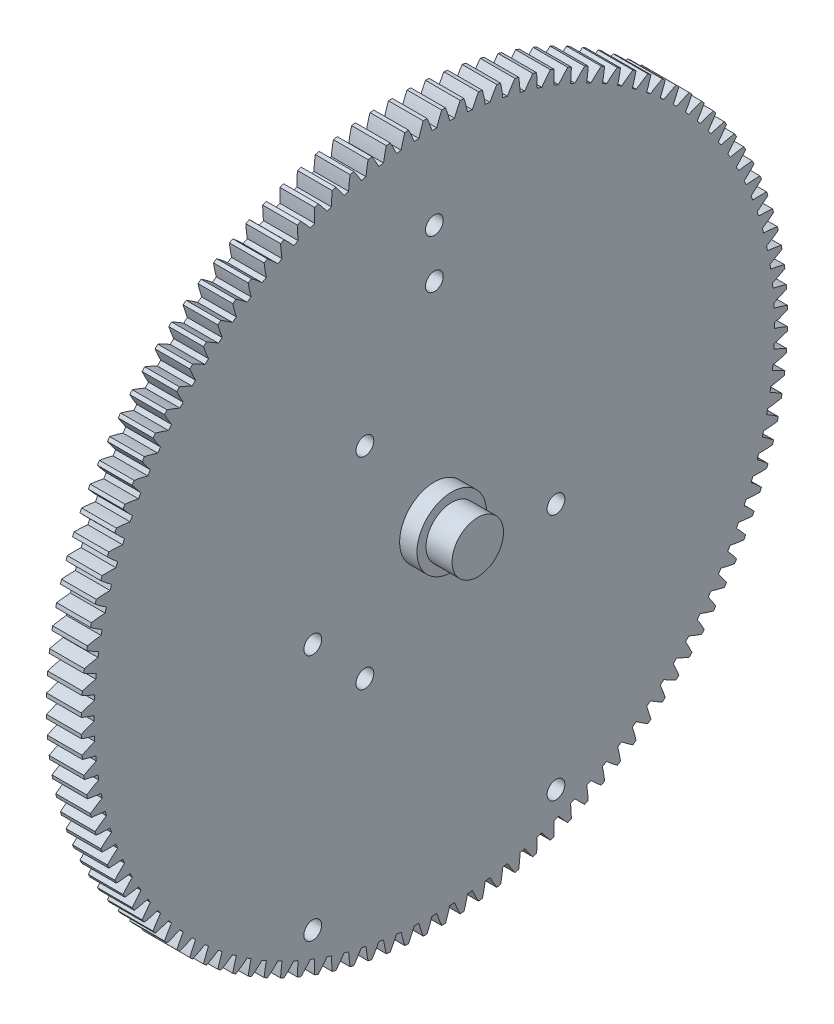
from build123d import *

# Parameters (mm, degrees)
BASPROSKE_W         = 12.7
BASPROSKE_H         = 129.116666667
TOOTHCUT_DEPTH      = 184.039660244
TEETHCUTS_COUNT     = 120
TEETHCUTS_ANGLE     = 357
SKETCH1_R           = 3.2512
CUT_EXTRUDE1_DEPTH  = 184.00052935
SKETCH2_R           = 12.699999999
BOSS_EXTRUDE1_DEPTH = 6.35
SKETCH3_R           = 9.397999999
BOSS_EXTRUDE2_DEPTH = 9.525


with BuildPart() as part:
    # BasProSke → Base-Revolve (revolve)
    with BuildSketch(Plane(origin=(0, 0, 0), x_dir=(1, 0, 0), z_dir=(0, 1, 0))):
        with Locations((6.35, 64.558333334)):
            Rectangle(BASPROSKE_W, BASPROSKE_H)
    revolve(axis=Axis((-10, 0, 0), (1, 0, 0)))

    # TooCutSke → ToothCut (cut, through all)
    with BuildSketch(Plane(origin=(0, 0, 0), x_dir=(0, 0, -1), z_dir=(1, 0, 0))):
        with BuildLine():
            ThreePointArc((0.87803111, 124.349796826), (0, 124.352896667), (-0.87803111, 124.349796826))
            ThreePointArc((-0.87803111, 124.349796826), (-1.722818551, 126.754652472), (-2.687169681, 129.114106518))
            ThreePointArc((-2.687169681, 129.114106518), (0, 129.142066667), (2.687169681, 129.114106518))
            ThreePointArc((2.687169681, 129.114106518), (1.722818551, 126.754652472), (0.87803111, 124.349796826))
        make_face()
    toothcut = extrude(amount=TOOTHCUT_DEPTH, mode=Mode.SUBTRACT)

    # TeethCuts: ToothCut ×120 about axis
    teethcuts_axis = Axis((-10, 0, 0), (1, 0, 0))
    for i in range(1, TEETHCUTS_COUNT):
        add(toothcut.rotate(teethcuts_axis, i * TEETHCUTS_ANGLE / (TEETHCUTS_COUNT - 1)), mode=Mode.SUBTRACT)

    # Sketch1 → Cut-Extrude1 (cut, through all)
    with BuildSketch(Plane.ZY):
        with Locations((25.4, 36.83)):
            Circle(SKETCH1_R)
        with Locations((25.4, -36.83)):
            Circle(SKETCH1_R)
        with Locations((0, 93.98)):
            Circle(SKETCH1_R)
        with Locations((0, 76.2)):
            Circle(SKETCH1_R)
        with Locations((44.45, -16.51)):
            Circle(SKETCH1_R)
        with Locations((44.45, -106.934)):
            Circle(SKETCH1_R)
        with Locations((-44.45, -106.934)):
            Circle(SKETCH1_R)
        with Locations((-44.45, -16.51)):
            Circle(SKETCH1_R)
    extrude(amount=-CUT_EXTRUDE1_DEPTH, mode=Mode.SUBTRACT)

    # Sketch2 → Boss-Extrude1 (add)
    with BuildSketch(Plane(origin=(12.7, 0, 0), x_dir=(0, 0, -1), z_dir=(1, 0, 0))):
        Circle(SKETCH2_R)
    extrude(amount=BOSS_EXTRUDE1_DEPTH)

    # Sketch3 → Boss-Extrude2 (add)
    with BuildSketch(Plane(origin=(19.05, 0, 0), x_dir=(0, 0, -1), z_dir=(1, 0, 0))):
        Circle(SKETCH3_R)
    extrude(amount=BOSS_EXTRUDE2_DEPTH)


solid = part.part
